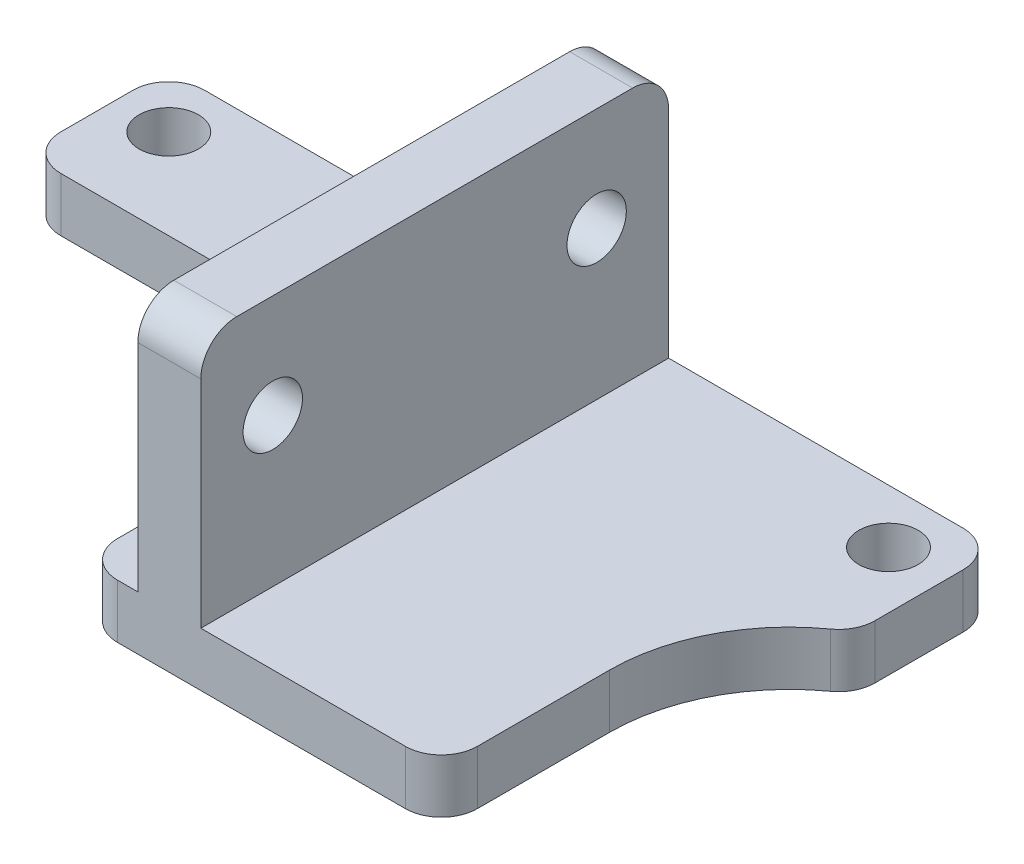
from build123d import *

# Parameters (mm, degrees)
SKETCH1_R           = 1.65
BOSS_EXTRUDE1_DEPTH = 3
SKETCH3_W           = 3.5
SKETCH3_H           = 26
BOSS_EXTRUDE2_DEPTH = 14
SKETCH5_W           = 21.15
SKETCH5_H           = 8
SKETCH5_R           = 1.65
BOSS_EXTRUDE4_DEPTH = 3
SKETCH6_R           = 1.65
CUT_EXTRUDE1_DEPTH  = 42.674073475
FILLET1_R           = 10
FILLET2_R           = 2
SKETCH7_R           = 2.75
CUT_EXTRUDE2_DEPTH  = 4.1


with BuildPart() as part:
    # Sketch1 → Boss-Extrude1 (new body)
    with BuildSketch(Plane(origin=(0, 0, 0), x_dir=(1, 0, 0), z_dir=(0, 1, 0))):
        Polygon((0, 0), (25, 0), (25, -8), (20, -8), (20, -26), (0, -26), align=None)
        with Locations(Location((21.85, -3, 0), (0, 0, 270))):
            Circle(SKETCH1_R, mode=Mode.SUBTRACT)
    extrude(amount=BOSS_EXTRUDE1_DEPTH)

    # Sketch3 → Boss-Extrude2 (add)
    with BuildSketch(Plane(origin=(0, 3, 0), x_dir=(1, 0, 0), z_dir=(0, 1, 0))):
        with Locations((4.88, -13)):
            Rectangle(SKETCH3_W, SKETCH3_H)
    extrude(amount=BOSS_EXTRUDE2_DEPTH)

    # Sketch5 → Boss-Extrude4 (add)
    with BuildSketch(Plane(origin=(0, 3, 0), x_dir=(1, 0, 0), z_dir=(0, 1, 0))):
        with Locations((-10.575, -4)):
            Rectangle(SKETCH5_W, SKETCH5_H)
        with Locations(Location((-18.15, -3, 0), (0, 0, 270))):
            Circle(SKETCH5_R, mode=Mode.SUBTRACT)
    extrude(amount=-BOSS_EXTRUDE4_DEPTH)

    # Sketch6 → Cut-Extrude1 (cut, through all)
    with BuildSketch(Plane(origin=(6.63, 0, 0), x_dir=(0, 0, -1), z_dir=(1, 0, 0))):
        with Locations((-4, 11.25)):
            Circle(SKETCH6_R)
        with Locations((-22, 11.25)):
            Circle(SKETCH6_R)
    extrude(amount=-CUT_EXTRUDE1_DEPTH, mode=Mode.SUBTRACT)

    # Fillet1
    # the kernel refuses this fillet: 10 mm, written as the material it adds along each edge
    with BuildSketch(Plane(origin=(20, 0, 8), x_dir=(0, 0, 1), z_dir=(0, 1, 0))) as fillet1_piece_1:
        with BuildLine():
            CenterArc((8.660254038, 10), FILLET1_R, 210, 60)
            Line((0, 5), (-0.173205081, 4.9))
            ThreePointArc((-0.173205081, 4.9), (-0.2, 2.5), (-0.2, 0))
            Line((-0.2, 0), (0, -0.2))
            Line((0, -0.2), (8.660254038, -0.2))
            Line((8.660254038, -0.2), (8.660254038, 0))
        make_face()
    extrude(amount=3)
    with BuildSketch(Plane(origin=(0, 3, 8), x_dir=(0, 0, 1), z_dir=(0, -1, 0))) as fillet1_piece_2:
        with BuildLine():
            CenterArc((FILLET1_R, FILLET1_R), FILLET1_R, 180, 90)
            Line((0, FILLET1_R), (-FILLET1_R * 0.02, FILLET1_R))
            Line((-FILLET1_R * 0.02, FILLET1_R), (-FILLET1_R * 0.02, -FILLET1_R * 0.02))
            Line((-FILLET1_R * 0.02, -FILLET1_R * 0.02), (FILLET1_R, -FILLET1_R * 0.02))
            Line((FILLET1_R, -FILLET1_R * 0.02), (FILLET1_R, 0))
        make_face()
    extrude(amount=3)

    # Fillet2
    fillet2_edges = [part.edges().sort_by_distance(p)[0] for p in [
        (25, 1.5, 0),
        (25, 1.5, 8),
        (20, 1.5, 26),
        (0, 1.5, 26),
        (4.88, 17, 26),
        (4.88, 17, 0),
        (-21.15, 1.5, 8),
        (-21.15, 1.5, 0),
    ]]
    fillet(fillet2_edges, radius=FILLET2_R)

    # Sketch7 → Cut-Extrude2 (cut)
    with BuildSketch(Plane.XZ):
        with Locations(Location((3.153923281, 3, 0), (0, 0, 270))):
            Circle(SKETCH7_R)
    extrude(amount=-CUT_EXTRUDE2_DEPTH, mode=Mode.SUBTRACT)


solid = part.part
